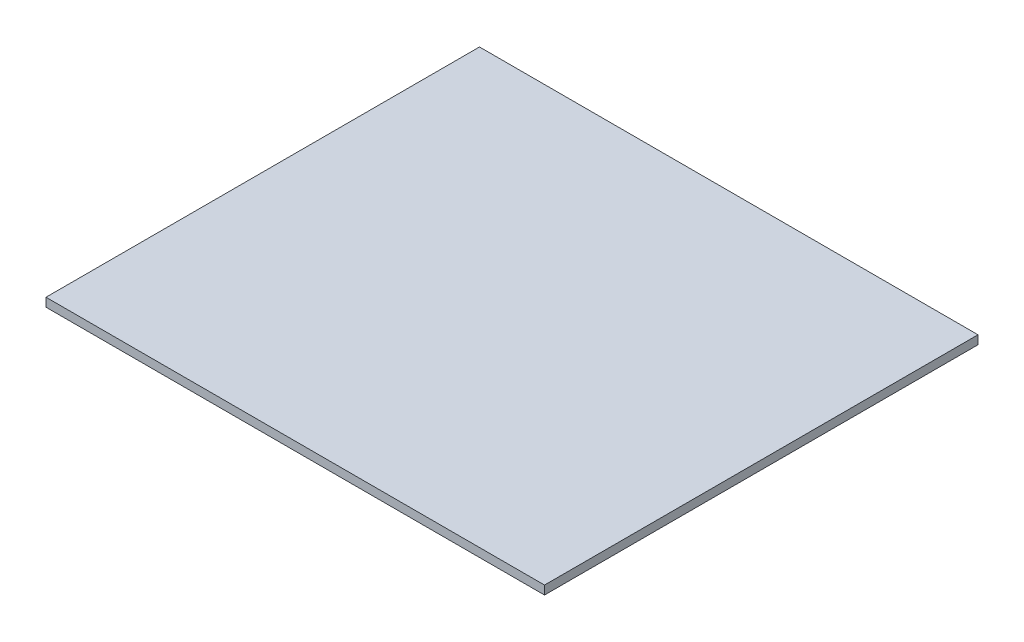
from build123d import *

# Parameters (mm, degrees)
SKETCH1_W           = 230
SKETCH1_H           = 200
BOSS_EXTRUDE1_DEPTH = 4


with BuildPart() as part:
    # Sketch1 → Boss-Extrude1 (new body)
    with BuildSketch(Plane(origin=(0, 0, 0), x_dir=(1, 0, 0), z_dir=(0, 1, 0))):
        Rectangle(SKETCH1_W, SKETCH1_H)
    extrude(amount=BOSS_EXTRUDE1_DEPTH)


solid = part.part
